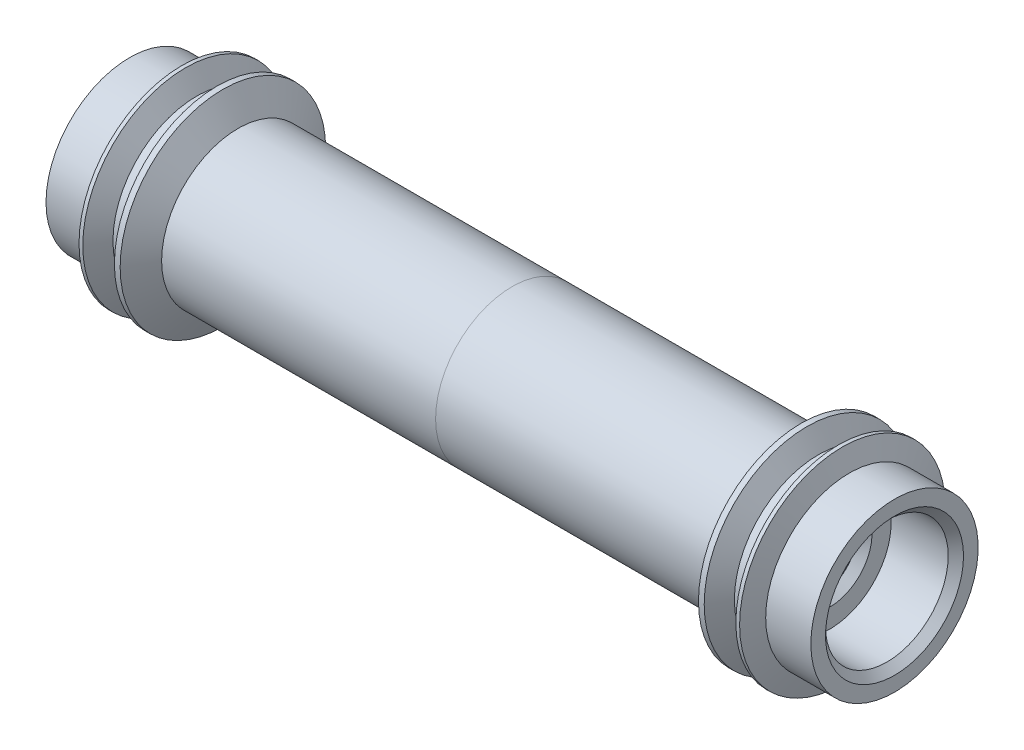
from build123d import *

# Parameters (mm, degrees)
CHAMFER1_SIZE = 0.508


with BuildPart() as part:
    # Sketch2 → Revolve1 (revolve)
    with BuildSketch(Plane.XY):
        Polygon((-22.4, 5.55625), (-25.4, 5.55625), (-25.4, 4.075), (-21.099999964, 4.075), (-21.099999964, 2.805), (-20.591999964, 2.297), (-20.591999964, 1.905), (-15.448, 1.905), (-15.448, 0), (-14.125000052, 0), (-12.5, 1.625000052), (0, 1.625000052), (0, 5.08), (-18.197567251, 5.08), (-19.205765158, 6.82625), (-19.586765158, 6.82625), (-20.32, 5.55625), (-20.955, 5.55625), (-21.688234842, 6.82625), (-21.937757802, 6.82625), align=None)
    revolve(axis=Axis((-25.4, 0, 0), (1, 0, 0)))

    # Chamfer1
    chamfer1_edges = [part.edges().sort_by_distance(p)[0] for p in [
        (-25.4, -4.075, 0),
    ]]
    chamfer(chamfer1_edges, length=CHAMFER1_SIZE)


with BuildPart() as body_2:
    # Mirror1: mirrored copy
    add(part.part.mirror(Plane(origin=(0, 0, 0), x_dir=(0, 0, 1), z_dir=(1, 0, 0))))


solid = Compound([part.part, body_2.part])
